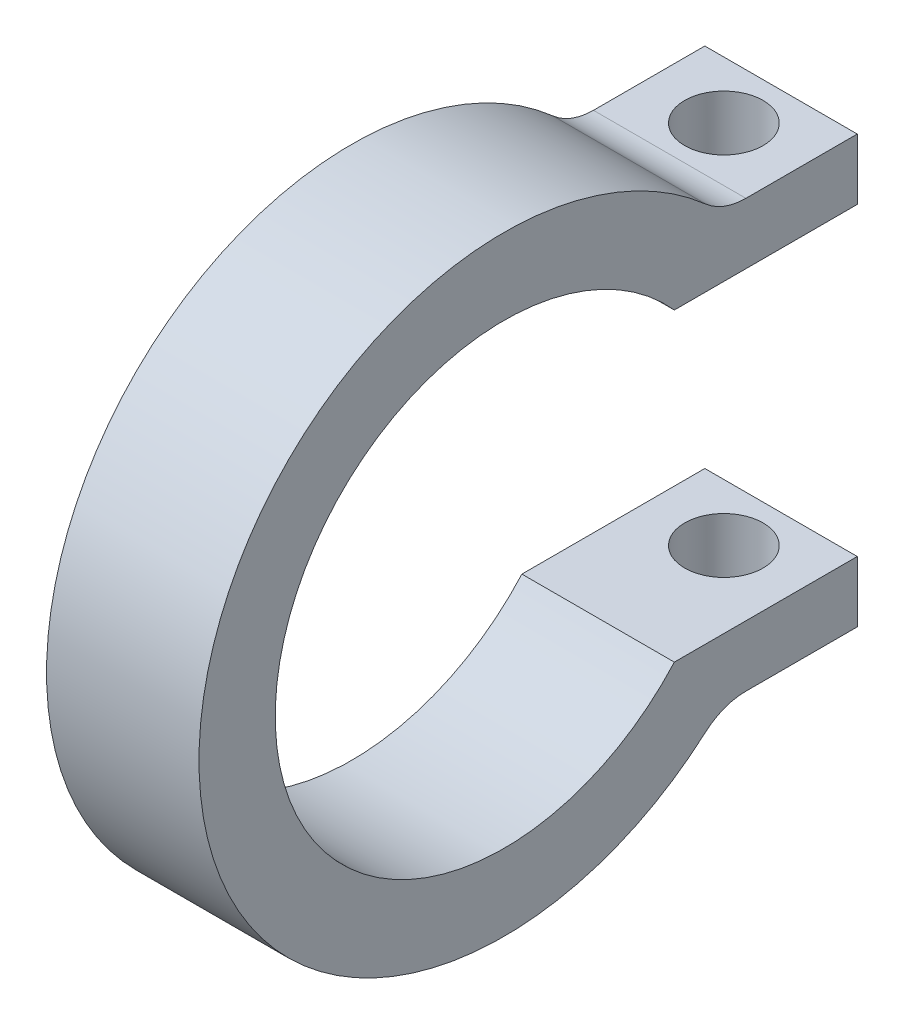
from build123d import *

# Parameters (mm, degrees)
BOSS_EXTRUDE1_DEPTH   = 6.35
F_4_CLEARANCE_HOLE1_D = 3.2639
FILLET2_R             = 2.54


with BuildPart() as part:
    # Sketch2 → Boss-Extrude1 (new body)
    with BuildSketch(Plane.YZ):
        with BuildLine():
            Line((-6.35, -7.099515829), (-6.35, -14.719515829))
            Line((-6.35, -14.719515829), (-8.89, -14.719515829))
            Line((-8.89, -14.719515829), (-8.89, -9.069614104))
            ThreePointArc((-8.89, -9.069614104), (0, 12.7), (8.89, -9.069614104))
            Line((8.89, -9.069614104), (8.89, -14.719515829))
            Line((8.89, -14.719515829), (6.35, -14.719515829))
            Line((6.35, -14.719515829), (6.35, -7.099515829))
            ThreePointArc((6.35, -7.099515829), (0, 9.525), (-6.35, -7.099515829))
        make_face()
    extrude(amount=BOSS_EXTRUDE1_DEPTH)

    # #4 Clearance Hole1 (through all)
    with Locations(Plane.XZ.offset(8.89)):
        with Locations((3.175, -12.338265829)):
            Hole(F_4_CLEARANCE_HOLE1_D / 2)

    # Fillet2
    fillet2_edges = [part.edges().sort_by_distance(p)[0] for p in [
        (3.175, 8.89, -9.069614104),
        (3.175, -8.89, -9.069614104),
    ]]
    fillet(fillet2_edges, radius=FILLET2_R)


solid = part.part
